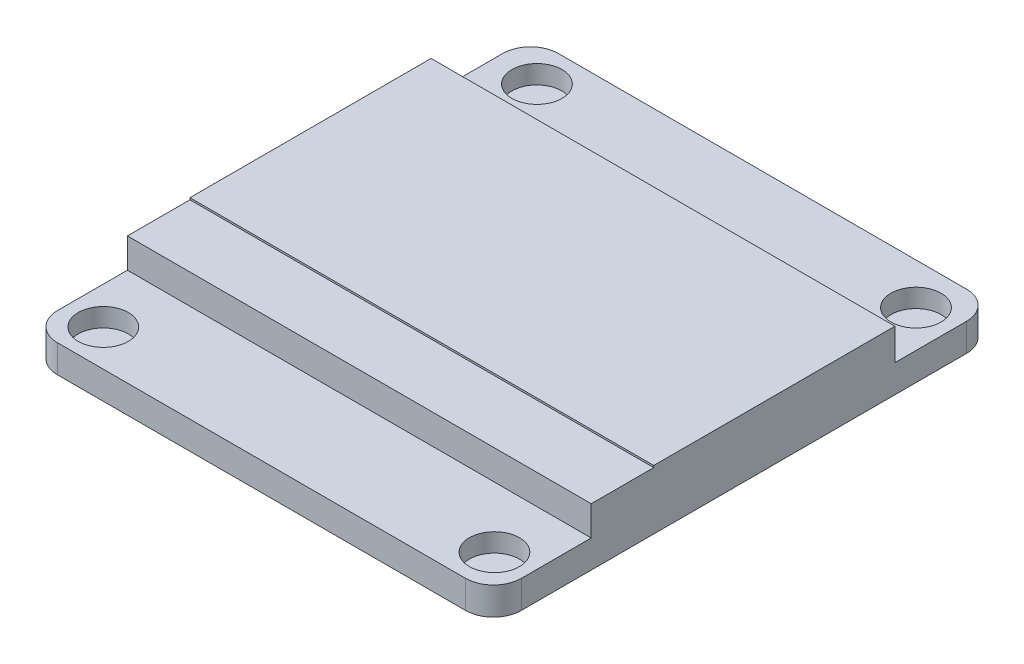
from build123d import *

# Parameters (mm, degrees)
EXTRUDE_1_DEPTH     = 1.5
SKETCH_3_R          = 1.35
CUT_EXTRUDE_1_DEPTH = 1
SKETCH_4_W          = 25
SKETCH_4_H          = 16.37
EXTRUDE_2_DEPTH     = 1.6
SKETCH_5_W          = 25
SKETCH_5_H          = 13
EXTRUDE_3_DEPTH     = 0.1


with BuildPart() as part:
    # 草图2 → 凸台-拉伸1 (new body)
    with BuildSketch(Plane(origin=(0, 0, 0), x_dir=(1, 0, 0), z_dir=(0, 1, 0))):
        with BuildLine():
            Line((-118.257462687, 92.332089552), (-96.257462687, 92.332089552))
            ThreePointArc((-96.257462687, 92.332089552), (-95.196802515, 91.892749724), (-94.757462687, 90.832089552))
            Line((-94.757462687, 90.832089552), (-94.757462687, 66.832089552))
            ThreePointArc((-94.757462687, 66.832089552), (-95.196802515, 65.77142938), (-96.257462687, 65.332089552))
            Line((-96.257462687, 65.332089552), (-118.257462687, 65.332089552))
            ThreePointArc((-118.257462687, 65.332089552), (-119.318122858, 65.77142938), (-119.757462687, 66.832089552))
            Line((-119.757462687, 66.832089552), (-119.757462687, 90.832089552))
            ThreePointArc((-119.757462687, 90.832089552), (-119.318122858, 91.892749724), (-118.257462687, 92.332089552))
        make_face()
    extrude(amount=EXTRUDE_1_DEPTH)

    # 草图3 → 切除-拉伸1 (cut)
    with BuildSketch(Plane(origin=(0, 1.5, 0), x_dir=(1, 0, 0), z_dir=(0, 1, 0))):
        with Locations((-117.412980345, 90.332089552)):
            Circle(SKETCH_3_R)
        with Locations((-96.757462687, 90.10796681)):
            Circle(SKETCH_3_R)
        with Locations((-96.704398074, 67.332089552)):
            Circle(SKETCH_3_R)
        with Locations((-117.757462687, 67.303227869)):
            Circle(SKETCH_3_R)
    extrude(amount=-CUT_EXTRUDE_1_DEPTH, mode=Mode.SUBTRACT)

    # 草图4 → 凸台-拉伸2 (add)
    with BuildSketch(Plane(origin=(0, 1.5, 0), x_dir=(1, 0, 0), z_dir=(0, 1, 0))):
        with Locations((-107.257462687, 78.787089552)):
            Rectangle(SKETCH_4_W, SKETCH_4_H)
    extrude(amount=EXTRUDE_2_DEPTH)

    # 草图5 → 凸台-拉伸3 (add)
    with BuildSketch(Plane(origin=(0, 3.1, 0), x_dir=(1, 0, 0), z_dir=(0, 1, 0))):
        with Locations((-107.257462687, 80.472089552)):
            Rectangle(SKETCH_5_W, SKETCH_5_H)
    extrude(amount=EXTRUDE_3_DEPTH)


solid = part.part
